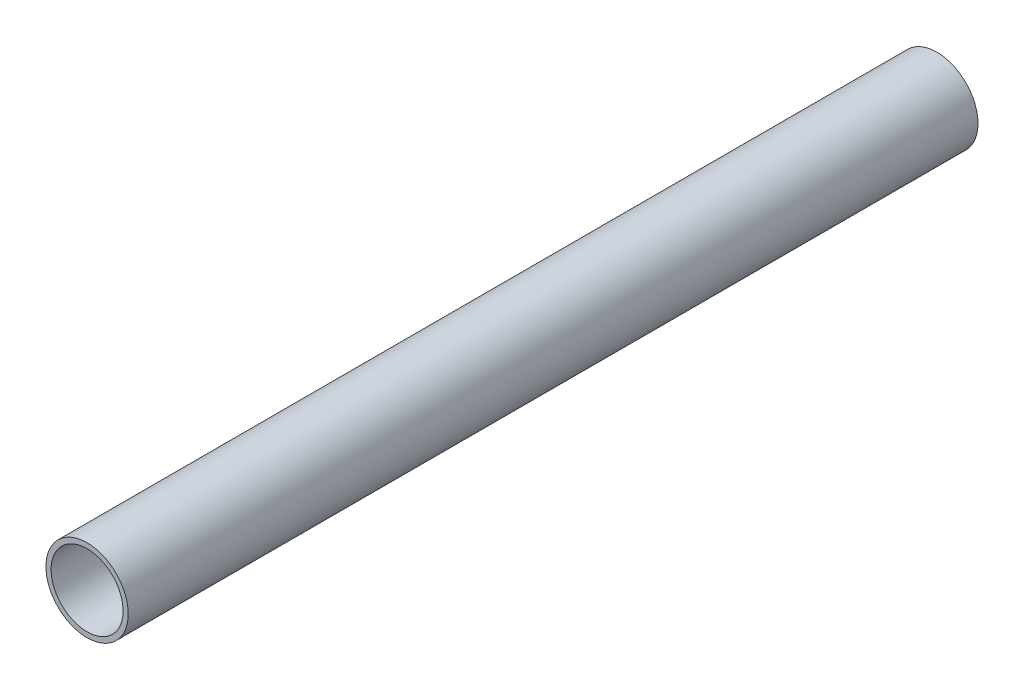
from build123d import *

# Parameters (mm, degrees)
SKETCH1_R           = 12.7
SKETCH1_R_2         = 11.1125
BOSS_EXTRUDE1_DEPTH = 262.18


with BuildPart() as part:
    # Sketch1 → Boss-Extrude1 (new body)
    with BuildSketch(Plane.XY):
        Circle(SKETCH1_R)
        Circle(SKETCH1_R_2, mode=Mode.SUBTRACT)
    extrude(amount=BOSS_EXTRUDE1_DEPTH)


solid = part.part
